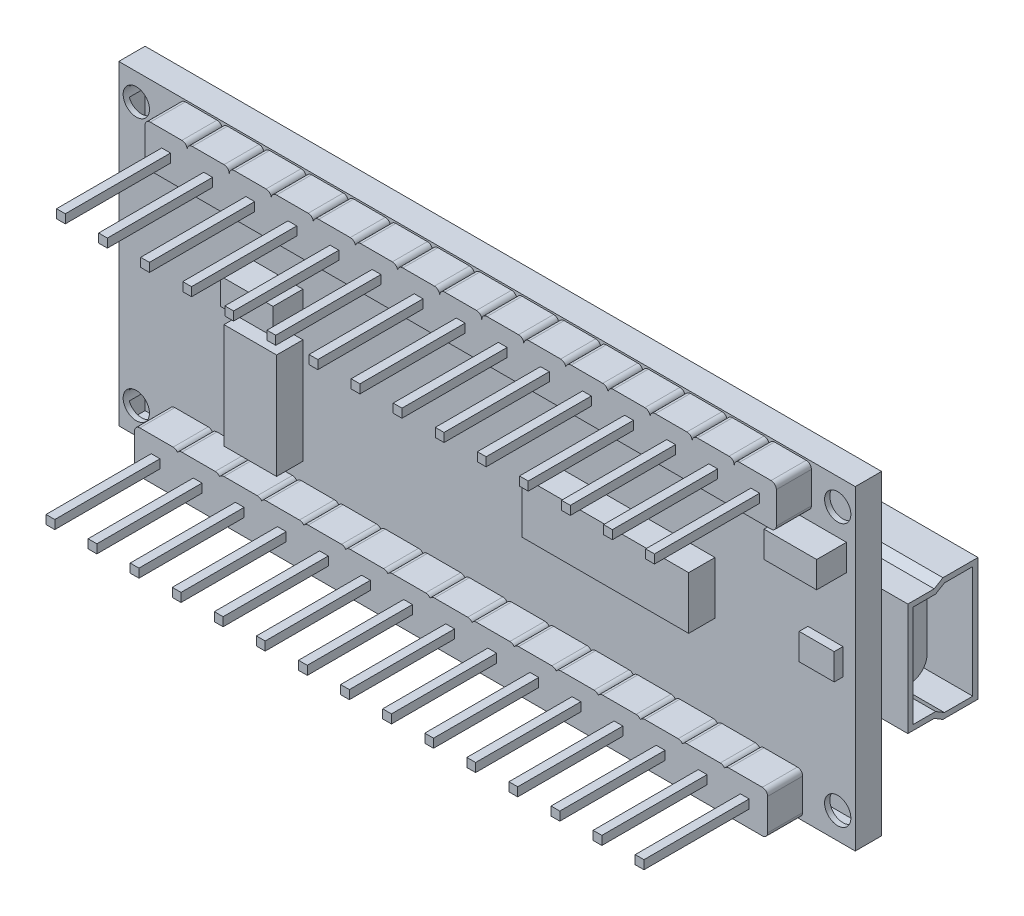
from build123d import *

# Parameters (mm, degrees)
SKETCH_1_W             = 42
SKETCH_1_H             = 18
EXTRUDE_1_DEPTH        = 1.5
SKETCH_2_W             = 9
SKETCH_2_H             = 7
EXTRUDE_2_DEPTH        = 4
CUT_EXTRUDE_1_DEPTH    = 9
SHELL_1_T              = -0.3
SKETCH_4_W             = 2
SKETCH_4_H             = 5
EXTRUDE_3_DEPTH        = 7
FILLET_1_R             = 1
SKETCH_5_W             = 5
SKETCH_5_H             = 8
EXTRUDE_4_DEPTH        = 2.5
EXTRUDE_6_DEPTH        = 1
SKETCH_8_W             = 3
SKETCH_8_H             = 6
EXTRUDE_7_DEPTH        = 1.5
SKETCH_9_W             = 2.2
SKETCH_9_H             = 5.2
EXTRUDE_8_DEPTH        = 0.4
SKETCH_10_W            = 1
SKETCH_10_H            = 2
EXTRUDE_9_DEPTH        = 0.7
EXTRUDE_10_DEPTH       = 0.5
SKETCH_12_W            = 2
SKETCH_12_H            = 1
EXTRUDE_11_DEPTH       = 0.5
SKETCH_13_W            = 1.9
SKETCH_13_H            = 1
EXTRUDE_12_DEPTH       = 0.45
SKETCH_14_R            = 0.75
CUT_EXTRUDE_2_DEPTH    = 48.246693006
SKETCH_15_W            = 2.4
SKETCH_15_H            = 2.4
SKETCH_15_W_2          = 2.5
EXTRUDE_14_DEPTH       = 2
FILLET_2_R             = 0.3
EXTRUDE_START          = -4
SKETCH_16_W            = 0.5
SKETCH_16_H            = 0.5
EXTRUDE_15_DEPTH       = 10
PATTERN_START          = 1.5
PATTERN_LINEAR_2_DEPTH = 2
SKETCH_17_W            = 9.5
SKETCH_17_H            = 3
SKETCH_17_W_2          = 3
SKETCH_17_H_2          = 6
EXTRUDE_16_DEPTH       = 1.5
SKETCH_18_W            = 3
SKETCH_18_H            = 1.5
EXTRUDE_17_DEPTH       = 1.7
SKETCH_19_W            = 2
SKETCH_19_H            = 1.5
EXTRUDE_18_DEPTH       = 0.5
PATTERN_LINEAR_3_COUNT = 15
PATTERN_LINEAR_3_PITCH = 2.4


# Read off the part's stored shape, not the designer's step: 阵列(线性)2
with BuildPart() as part:
    # 草图1 → 凸台-拉伸1 (new body)
    with BuildSketch(Plane.XY):
        with Locations((21, 9)):
            Rectangle(SKETCH_1_W, SKETCH_1_H)
    extrude(amount=EXTRUDE_1_DEPTH)

    # 草图2 → 凸台-拉伸2 (add)
    with BuildSketch(Plane(origin=(0, 0, 0), x_dir=(-1, 0, 0), z_dir=(0, 0, -1))):
        with Locations((-39, 9)):
            Rectangle(SKETCH_2_W, SKETCH_2_H)
    extrude(amount=EXTRUDE_2_DEPTH)

    # 草图3 → 切除-拉伸1 (cut)
    with BuildSketch(Plane(origin=(43.5, 0, 0), x_dir=(0, 0, -1), z_dir=(1, 0, 0))):
        Polygon((2, 12.5), (1.5, 12.2), (0, 12.2), (0, 12.5), align=None)
        Polygon((2, 5.5), (1.5, 5.8), (0, 5.8), (0, 5.5), align=None)
    extrude(amount=-CUT_EXTRUDE_1_DEPTH, mode=Mode.SUBTRACT)

    # 抽壳1
    shell_1_openings = [part.faces().sort_by_distance(p)[0] for p in [
        (43.5, 9, -2.043599258),
    ]]
    offset(amount=SHELL_1_T, openings=shell_1_openings, kind=Kind.INTERSECTION)

    # 草图4 → 凸台-拉伸3 (add)
    with BuildSketch(Plane(origin=(34.8, 0, 0), x_dir=(0, 0, -1), z_dir=(1, 0, 0))):
        with Locations((1.8, 9)):
            Rectangle(SKETCH_4_W, SKETCH_4_H)
    extrude(amount=EXTRUDE_3_DEPTH)

    # 圆角1
    fillet_1_edges = [part.edges().sort_by_distance(p)[0] for p in [
        (38.3, 11.5, -0.8),
        (38.3, 6.5, -0.8),
        (38.3, 6.5, -2.8),
        (38.3, 11.5, -2.8),
    ]]
    fillet(fillet_1_edges, radius=FILLET_1_R - 0.0001)  # a hair under: the kernel refuses the full size

    # 草图5 → 凸台-拉伸4 (add)
    with BuildSketch(Plane(origin=(0, 0, 0), x_dir=(-1, 0, 0), z_dir=(0, 0, -1))):
        with Locations((-2.6, 9)):
            Rectangle(SKETCH_5_W, SKETCH_5_H)
    extrude(amount=EXTRUDE_4_DEPTH)

    # 草图7 → 凸台-拉伸6 (add)
    with BuildSketch(Plane(origin=(0, 0, 0), x_dir=(-1, 0, 0), z_dir=(0, 0, -1))):
        Polygon((-31.5, 9), (-26.5, 4), (-21.5, 9), (-26.5, 14), align=None)
    extrude(amount=EXTRUDE_6_DEPTH)

    # 草图8 → 凸台-拉伸7 (add)
    with BuildSketch(Plane(origin=(0, 0, 0), x_dir=(-1, 0, 0), z_dir=(0, 0, -1))):
        with Locations((-16, 9)):
            Rectangle(SKETCH_8_W, SKETCH_8_H)
    extrude(amount=EXTRUDE_7_DEPTH)

    # 草图9 → 凸台-拉伸8 (add)
    with BuildSketch(Plane(origin=(0, 0, -1.5), x_dir=(-1, 0, 0), z_dir=(0, 0, -1))):
        with Locations((-16, 9)):
            Rectangle(SKETCH_9_W, SKETCH_9_H)
    extrude(amount=EXTRUDE_8_DEPTH)

    # 草图10 → 凸台-拉伸9 (add)
    with BuildSketch(Plane(origin=(0, 0, -1.9), x_dir=(-1, 0, 0), z_dir=(0, 0, -1))):
        with Locations((-16, 9)):
            Rectangle(SKETCH_10_W, SKETCH_10_H)
    extrude(amount=EXTRUDE_9_DEPTH)

    # 草图11 → 凸台-拉伸10 (add)
    with BuildSketch(Plane(origin=(0, 0, 0), x_dir=(-1, 0, 0), z_dir=(0, 0, -1))):
        Polygon((-20.792893219, 11.121320344), (-22.914213562, 13.242640687), (-22.207106781, 13.949747468), (-20.085786438, 11.828427125), align=None)
    extrude(amount=EXTRUDE_10_DEPTH)

    # 草图12 → 凸台-拉伸11 (add)
    with BuildSketch(Plane(origin=(0, 0, 0), x_dir=(-1, 0, 0), z_dir=(0, 0, -1))):
        with Locations((-8.6, 5.25)):
            Rectangle(SKETCH_12_W, SKETCH_12_H)
        with Locations((-8.6, 12.75)):
            Rectangle(SKETCH_12_W, SKETCH_12_H)
        with Locations((-8.6, 7.75)):
            Rectangle(SKETCH_12_W, SKETCH_12_H)
        with Locations((-8.6, 10.25)):
            Rectangle(SKETCH_12_W, SKETCH_12_H)
    extrude(amount=EXTRUDE_11_DEPTH)

    # 草图13 → 凸台-拉伸12 (add)
    with BuildSketch(Plane(origin=(0, 0, 0), x_dir=(-1, 0, 0), z_dir=(0, 0, -1))):
        with Locations((-11.75, 5.25)):
            Rectangle(SKETCH_13_W, SKETCH_13_H)
        with Locations((-11.75, 7.75)):
            Rectangle(SKETCH_13_W, SKETCH_13_H)
        with Locations((-11.75, 10.25)):
            Rectangle(SKETCH_13_W, SKETCH_13_H)
        with Locations((-11.75, 12.75)):
            Rectangle(SKETCH_13_W, SKETCH_13_H)
    extrude(amount=EXTRUDE_12_DEPTH)

    # 草图14 → 切除-拉伸2 (cut, through all)
    with BuildSketch(Plane(origin=(0, 0, 0), x_dir=(-1, 0, 0), z_dir=(0, 0, -1))):
        with Locations((-41, 1.5)):
            Circle(SKETCH_14_R)
        with Locations((-1, 16.5)):
            Circle(SKETCH_14_R)
        with Locations((-1, 1.5)):
            Circle(SKETCH_14_R)
        with Locations((-41, 16.5)):
            Circle(SKETCH_14_R)
    extrude(amount=-CUT_EXTRUDE_2_DEPTH, mode=Mode.SUBTRACT)

    # 草图15 → 凸台-拉伸14 (add)
    with BuildSketch(Plane.XY.offset(1.5)):
        with Locations((38.3, 16.7)):
            Rectangle(SKETCH_15_W, SKETCH_15_H)
        with Locations((37.75, 1.3)):
            Rectangle(SKETCH_15_W_2, SKETCH_15_H)
    extrude(amount=EXTRUDE_14_DEPTH)

    # 圆角2
    fillet_2_edges = [part.edges().sort_by_distance(p)[0] for p in [
        (39.5, 15.5, 2.5),
        (39.5, 17.9, 2.5),
        (37.1, 17.9, 2.5),
        (37.1, 15.5, 2.5),
        (39, 0.1, 2.5),
        (39, 2.5, 2.5),
        (36.5, 2.5, 2.5),
        (36.5, 0.1, 2.5),
    ]]
    fillet(fillet_2_edges, radius=FILLET_2_R)

    # 草图16 → 凸台-拉伸15 (add)
    with BuildSketch(Plane.XY.offset(3.5).offset(EXTRUDE_START)):
        with Locations((38.3, 16.7)):
            Rectangle(SKETCH_16_W, SKETCH_16_H)
        with Locations((37.7, 1.3)):
            Rectangle(SKETCH_16_W, SKETCH_16_H)
    extrude_15 = extrude(amount=EXTRUDE_15_DEPTH)

    # 阵列(线性)2 outline → 阵列(线性)2 (add)
    with BuildSketch(Plane.XY.offset(PATTERN_START)):
        with BuildLine():
            Line((36.8, 17.9), (35, 17.9))
            ThreePointArc((35, 17.9), (34.787867966, 17.812132034), (34.7, 17.6))
            ThreePointArc((34.7, 17.6), (34.612132034, 17.812132034), (34.4, 17.9))
            Line((34.4, 17.9), (32.6, 17.9))
            ThreePointArc((32.6, 17.9), (32.387867966, 17.812132034), (32.3, 17.6))
            ThreePointArc((32.3, 17.6), (32.212132034, 17.812132034), (32, 17.9))
            Line((32, 17.9), (30.2, 17.9))
            ThreePointArc((30.2, 17.9), (29.987867966, 17.812132034), (29.9, 17.6))
            ThreePointArc((29.9, 17.6), (29.812132034, 17.812132034), (29.6, 17.9))
            Line((29.6, 17.9), (27.8, 17.9))
            ThreePointArc((27.8, 17.9), (27.587867966, 17.812132034), (27.5, 17.6))
            ThreePointArc((27.5, 17.6), (27.412132034, 17.812132034), (27.2, 17.9))
            Line((27.2, 17.9), (25.4, 17.9))
            ThreePointArc((25.4, 17.9), (25.187867966, 17.812132034), (25.1, 17.6))
            ThreePointArc((25.1, 17.6), (25.012132034, 17.812132034), (24.8, 17.9))
            Line((24.8, 17.9), (23, 17.9))
            ThreePointArc((23, 17.9), (22.787867966, 17.812132034), (22.7, 17.6))
            ThreePointArc((22.7, 17.6), (22.612132034, 17.812132034), (22.4, 17.9))
            Line((22.4, 17.9), (20.6, 17.9))
            ThreePointArc((20.6, 17.9), (20.387867966, 17.812132034), (20.3, 17.6))
            ThreePointArc((20.3, 17.6), (20.212132034, 17.812132034), (20, 17.9))
            Line((20, 17.9), (18.2, 17.9))
            ThreePointArc((18.2, 17.9), (17.987867966, 17.812132034), (17.9, 17.6))
            ThreePointArc((17.9, 17.6), (17.812132034, 17.812132034), (17.6, 17.9))
            Line((17.6, 17.9), (15.8, 17.9))
            ThreePointArc((15.8, 17.9), (15.587867966, 17.812132034), (15.5, 17.6))
            ThreePointArc((15.5, 17.6), (15.412132034, 17.812132034), (15.2, 17.9))
            Line((15.2, 17.9), (13.4, 17.9))
            ThreePointArc((13.4, 17.9), (13.187867966, 17.812132034), (13.1, 17.6))
            ThreePointArc((13.1, 17.6), (13.012132034, 17.812132034), (12.8, 17.9))
            Line((12.8, 17.9), (11, 17.9))
            ThreePointArc((11, 17.9), (10.787867966, 17.812132034), (10.7, 17.6))
            ThreePointArc((10.7, 17.6), (10.612132034, 17.812132034), (10.4, 17.9))
            Line((10.4, 17.9), (8.6, 17.9))
            ThreePointArc((8.6, 17.9), (8.387867966, 17.812132034), (8.3, 17.6))
            ThreePointArc((8.3, 17.6), (8.212132034, 17.812132034), (8, 17.9))
            Line((8, 17.9), (6.2, 17.9))
            ThreePointArc((6.2, 17.9), (5.987867966, 17.812132034), (5.9, 17.6))
            ThreePointArc((5.9, 17.6), (5.812132034, 17.812132034), (5.6, 17.9))
            Line((5.6, 17.9), (3.8, 17.9))
            ThreePointArc((3.8, 17.9), (3.587867966, 17.812132034), (3.5, 17.6))
            Line((3.5, 17.6), (3.5, 15.8))
            ThreePointArc((3.5, 15.8), (3.587867966, 15.587867966), (3.8, 15.5))
            Line((3.8, 15.5), (5.6, 15.5))
            ThreePointArc((5.6, 15.5), (5.812132034, 15.587867966), (5.9, 15.8))
            ThreePointArc((5.9, 15.8), (5.987867966, 15.587867966), (6.2, 15.5))
            Line((6.2, 15.5), (8, 15.5))
            ThreePointArc((8, 15.5), (8.212132034, 15.587867966), (8.3, 15.8))
            ThreePointArc((8.3, 15.8), (8.387867966, 15.587867966), (8.6, 15.5))
            Line((8.6, 15.5), (10.4, 15.5))
            ThreePointArc((10.4, 15.5), (10.612132034, 15.587867966), (10.7, 15.8))
            ThreePointArc((10.7, 15.8), (10.787867966, 15.587867966), (11, 15.5))
            Line((11, 15.5), (12.8, 15.5))
            ThreePointArc((12.8, 15.5), (13.012132034, 15.587867966), (13.1, 15.8))
            ThreePointArc((13.1, 15.8), (13.187867966, 15.587867966), (13.4, 15.5))
            Line((13.4, 15.5), (15.2, 15.5))
            ThreePointArc((15.2, 15.5), (15.412132034, 15.587867966), (15.5, 15.8))
            ThreePointArc((15.5, 15.8), (15.587867966, 15.587867966), (15.8, 15.5))
            Line((15.8, 15.5), (17.6, 15.5))
            ThreePointArc((17.6, 15.5), (17.812132034, 15.587867966), (17.9, 15.8))
            ThreePointArc((17.9, 15.8), (17.987867966, 15.587867966), (18.2, 15.5))
            Line((18.2, 15.5), (20, 15.5))
            ThreePointArc((20, 15.5), (20.212132034, 15.587867966), (20.3, 15.8))
            ThreePointArc((20.3, 15.8), (20.387867966, 15.587867966), (20.6, 15.5))
            Line((20.6, 15.5), (22.4, 15.5))
            ThreePointArc((22.4, 15.5), (22.612132034, 15.587867966), (22.7, 15.8))
            ThreePointArc((22.7, 15.8), (22.787867966, 15.587867966), (23, 15.5))
            Line((23, 15.5), (24.8, 15.5))
            ThreePointArc((24.8, 15.5), (25.012132034, 15.587867966), (25.1, 15.8))
            ThreePointArc((25.1, 15.8), (25.187867966, 15.587867966), (25.4, 15.5))
            Line((25.4, 15.5), (27.2, 15.5))
            ThreePointArc((27.2, 15.5), (27.412132034, 15.587867966), (27.5, 15.8))
            ThreePointArc((27.5, 15.8), (27.587867966, 15.587867966), (27.8, 15.5))
            Line((27.8, 15.5), (29.6, 15.5))
            ThreePointArc((29.6, 15.5), (29.812132034, 15.587867966), (29.9, 15.8))
            ThreePointArc((29.9, 15.8), (29.987867966, 15.587867966), (30.2, 15.5))
            Line((30.2, 15.5), (32, 15.5))
            ThreePointArc((32, 15.5), (32.212132034, 15.587867966), (32.3, 15.8))
            ThreePointArc((32.3, 15.8), (32.387867966, 15.587867966), (32.6, 15.5))
            Line((32.6, 15.5), (34.4, 15.5))
            ThreePointArc((34.4, 15.5), (34.612132034, 15.587867966), (34.7, 15.8))
            ThreePointArc((34.7, 15.8), (34.787867966, 15.587867966), (35, 15.5))
            Line((35, 15.5), (36.8, 15.5))
            ThreePointArc((36.8, 15.5), (37.012132034, 15.587867966), (37.1, 15.8))
            Line((37.1, 15.8), (37.1, 17.6))
            ThreePointArc((37.1, 17.6), (37.012132034, 17.812132034), (36.8, 17.9))
        make_face()
        with BuildLine():
            Line((36.3, 2.5), (34.4, 2.5))
            ThreePointArc((34.4, 2.5), (34.258136283, 2.464338204), (34.15, 2.36583124))
            ThreePointArc((34.15, 2.36583124), (34.041863717, 2.464338204), (33.9, 2.5))
            Line((33.9, 2.5), (32, 2.5))
            ThreePointArc((32, 2.5), (31.858136283, 2.464338204), (31.75, 2.36583124))
            ThreePointArc((31.75, 2.36583124), (31.641863717, 2.464338204), (31.5, 2.5))
            Line((31.5, 2.5), (29.6, 2.5))
            ThreePointArc((29.6, 2.5), (29.458136283, 2.464338204), (29.35, 2.36583124))
            ThreePointArc((29.35, 2.36583124), (29.241863717, 2.464338204), (29.1, 2.5))
            Line((29.1, 2.5), (27.2, 2.5))
            ThreePointArc((27.2, 2.5), (27.058136283, 2.464338204), (26.95, 2.36583124))
            ThreePointArc((26.95, 2.36583124), (26.841863717, 2.464338204), (26.7, 2.5))
            Line((26.7, 2.5), (24.8, 2.5))
            ThreePointArc((24.8, 2.5), (24.658136283, 2.464338204), (24.55, 2.36583124))
            ThreePointArc((24.55, 2.36583124), (24.441863717, 2.464338204), (24.3, 2.5))
            Line((24.3, 2.5), (22.4, 2.5))
            ThreePointArc((22.4, 2.5), (22.258136283, 2.464338204), (22.15, 2.36583124))
            ThreePointArc((22.15, 2.36583124), (22.041863717, 2.464338204), (21.9, 2.5))
            Line((21.9, 2.5), (20, 2.5))
            ThreePointArc((20, 2.5), (19.858136283, 2.464338204), (19.75, 2.36583124))
            ThreePointArc((19.75, 2.36583124), (19.641863717, 2.464338204), (19.5, 2.5))
            Line((19.5, 2.5), (17.6, 2.5))
            ThreePointArc((17.6, 2.5), (17.458136283, 2.464338204), (17.35, 2.36583124))
            ThreePointArc((17.35, 2.36583124), (17.241863717, 2.464338204), (17.1, 2.5))
            Line((17.1, 2.5), (15.2, 2.5))
            ThreePointArc((15.2, 2.5), (15.058136283, 2.464338204), (14.95, 2.36583124))
            ThreePointArc((14.95, 2.36583124), (14.841863717, 2.464338204), (14.7, 2.5))
            Line((14.7, 2.5), (12.8, 2.5))
            ThreePointArc((12.8, 2.5), (12.658136283, 2.464338204), (12.55, 2.36583124))
            ThreePointArc((12.55, 2.36583124), (12.441863717, 2.464338204), (12.3, 2.5))
            Line((12.3, 2.5), (10.4, 2.5))
            ThreePointArc((10.4, 2.5), (10.258136283, 2.464338204), (10.15, 2.36583124))
            ThreePointArc((10.15, 2.36583124), (10.041863717, 2.464338204), (9.9, 2.5))
            Line((9.9, 2.5), (8, 2.5))
            ThreePointArc((8, 2.5), (7.858136283, 2.464338204), (7.75, 2.36583124))
            ThreePointArc((7.75, 2.36583124), (7.641863717, 2.464338204), (7.5, 2.5))
            Line((7.5, 2.5), (5.6, 2.5))
            ThreePointArc((5.6, 2.5), (5.458136283, 2.464338204), (5.35, 2.36583124))
            ThreePointArc((5.35, 2.36583124), (5.241863717, 2.464338204), (5.1, 2.5))
            Line((5.1, 2.5), (3.2, 2.5))
            ThreePointArc((3.2, 2.5), (2.987867966, 2.412132034), (2.9, 2.2))
            Line((2.9, 2.2), (2.9, 0.4))
            ThreePointArc((2.9, 0.4), (2.987867966, 0.187867966), (3.2, 0.1))
            Line((3.2, 0.1), (5.1, 0.1))
            ThreePointArc((5.1, 0.1), (5.241863717, 0.135661796), (5.35, 0.23416876))
            ThreePointArc((5.35, 0.23416876), (5.458136283, 0.135661796), (5.6, 0.1))
            Line((5.6, 0.1), (7.5, 0.1))
            ThreePointArc((7.5, 0.1), (7.641863717, 0.135661796), (7.75, 0.23416876))
            ThreePointArc((7.75, 0.23416876), (7.858136283, 0.135661796), (8, 0.1))
            Line((8, 0.1), (9.9, 0.1))
            ThreePointArc((9.9, 0.1), (10.041863717, 0.135661796), (10.15, 0.23416876))
            ThreePointArc((10.15, 0.23416876), (10.258136283, 0.135661796), (10.4, 0.1))
            Line((10.4, 0.1), (12.3, 0.1))
            ThreePointArc((12.3, 0.1), (12.441863717, 0.135661796), (12.55, 0.23416876))
            ThreePointArc((12.55, 0.23416876), (12.658136283, 0.135661796), (12.8, 0.1))
            Line((12.8, 0.1), (14.7, 0.1))
            ThreePointArc((14.7, 0.1), (14.841863717, 0.135661796), (14.95, 0.23416876))
            ThreePointArc((14.95, 0.23416876), (15.058136283, 0.135661796), (15.2, 0.1))
            Line((15.2, 0.1), (17.1, 0.1))
            ThreePointArc((17.1, 0.1), (17.241863717, 0.135661796), (17.35, 0.23416876))
            ThreePointArc((17.35, 0.23416876), (17.458136283, 0.135661796), (17.6, 0.1))
            Line((17.6, 0.1), (19.5, 0.1))
            ThreePointArc((19.5, 0.1), (19.641863717, 0.135661796), (19.75, 0.23416876))
            ThreePointArc((19.75, 0.23416876), (19.858136283, 0.135661796), (20, 0.1))
            Line((20, 0.1), (21.9, 0.1))
            ThreePointArc((21.9, 0.1), (22.041863717, 0.135661796), (22.15, 0.23416876))
            ThreePointArc((22.15, 0.23416876), (22.258136283, 0.135661796), (22.4, 0.1))
            Line((22.4, 0.1), (24.3, 0.1))
            ThreePointArc((24.3, 0.1), (24.441863717, 0.135661796), (24.55, 0.23416876))
            ThreePointArc((24.55, 0.23416876), (24.658136283, 0.135661796), (24.8, 0.1))
            Line((24.8, 0.1), (26.7, 0.1))
            ThreePointArc((26.7, 0.1), (26.841863717, 0.135661796), (26.95, 0.23416876))
            ThreePointArc((26.95, 0.23416876), (27.058136283, 0.135661796), (27.2, 0.1))
            Line((27.2, 0.1), (29.1, 0.1))
            ThreePointArc((29.1, 0.1), (29.241863717, 0.135661796), (29.35, 0.23416876))
            ThreePointArc((29.35, 0.23416876), (29.458136283, 0.135661796), (29.6, 0.1))
            Line((29.6, 0.1), (31.5, 0.1))
            ThreePointArc((31.5, 0.1), (31.641863717, 0.135661796), (31.75, 0.23416876))
            ThreePointArc((31.75, 0.23416876), (31.858136283, 0.135661796), (32, 0.1))
            Line((32, 0.1), (33.9, 0.1))
            ThreePointArc((33.9, 0.1), (34.041863717, 0.135661796), (34.15, 0.23416876))
            ThreePointArc((34.15, 0.23416876), (34.258136283, 0.135661796), (34.4, 0.1))
            Line((34.4, 0.1), (36.3, 0.1))
            ThreePointArc((36.3, 0.1), (36.441863717, 0.135661796), (36.55, 0.23416876))
            ThreePointArc((36.55, 0.23416876), (36.512771868, 0.31339746), (36.5, 0.4))
            Line((36.5, 0.4), (36.5, 2.2))
            ThreePointArc((36.5, 2.2), (36.512771868, 2.28660254), (36.550000001, 2.36583124))
            ThreePointArc((36.550000001, 2.36583124), (36.441863717, 2.464338204), (36.3, 2.5))
        make_face()
    extrude(amount=PATTERN_LINEAR_2_DEPTH)

    # 草图17 → 凸台-拉伸16 (add)
    with BuildSketch(Plane.XY.offset(1.5)):
        with Locations((29.25, 9)):
            Rectangle(SKETCH_17_W, SKETCH_17_H)
        with Locations((9, 6.5)):
            Rectangle(SKETCH_17_W_2, SKETCH_17_H_2)
    extrude(amount=EXTRUDE_16_DEPTH)

    # 草图18 → 凸台-拉伸17 (add)
    with BuildSketch(Plane.XY.offset(1.5)):
        with Locations((40, 14.25)):
            Rectangle(SKETCH_18_W, SKETCH_18_H)
        with Locations((9, 11.25)):
            Rectangle(SKETCH_18_W, SKETCH_18_H)
    extrude(amount=EXTRUDE_17_DEPTH)

    # 草图19 → 凸台-拉伸18 (add)
    with BuildSketch(Plane.XY.offset(1.5)):
        with Locations((40.3, 9)):
            Rectangle(SKETCH_19_W, SKETCH_19_H)
    extrude(amount=EXTRUDE_18_DEPTH)

    # 阵列(线性)3: 凸台-拉伸15 ×15
    with Locations(*[(-i * PATTERN_LINEAR_3_PITCH, 0, 0) for i in range(1, PATTERN_LINEAR_3_COUNT)]):
        add(extrude_15)


solid = part.part
